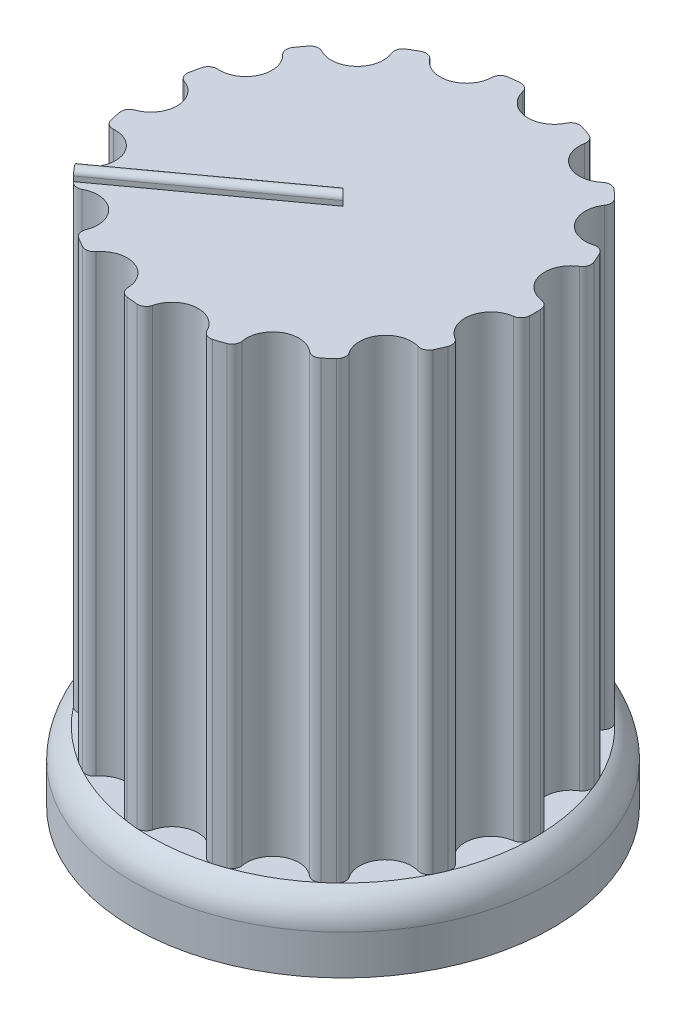
from build123d import *

# Parameters (mm, degrees)
SKETCH1_R                = 6
BOSS_EXTRUDE1_DEPTH      = 15
CUT_EXTRUDE1_START       = -13
SKETCH2_R                = 6
SKETCH2_R_2              = 5.5
CUT_EXTRUDE1_DEPTH       = 13
FILLET1_R                = 1
SKETCH3_R                = 0.75
CUT_EXTRUDE2_DEPTH       = 13
FILLET2_R                = 0.25
CIRPATTERN1_COUNT        = 15
FILLET2_OF_CIRPATTERN1_R = 0.25
SKETCH4_R                = 3.5
CUT_EXTRUDE3_DEPTH       = 14
BOSS_EXTRUDE2_DEPTH      = 7
FILLET3_R                = 0.25
BOSS_EXTRUDE3_DEPTH      = 0.3
FILLET4_R                = 0.159518


# Some blends are built 0.0001 mm under size
with BuildPart() as part:
    # Sketch1 → Boss-Extrude1 (new body)
    with BuildSketch(Plane(origin=(0, 0, 0), x_dir=(1, 0, 0), z_dir=(0, 1, 0))):
        with Locations(Location((0, 0, 0), (0, 0, 270))):
            Circle(SKETCH1_R)
    extrude(amount=BOSS_EXTRUDE1_DEPTH)

    # Sketch2 → Cut-Extrude1 (cut)
    with BuildSketch(Plane(origin=(0, 15, 0), x_dir=(1, 0, 0), z_dir=(0, 1, 0)).offset(CUT_EXTRUDE1_START)):
        with Locations(Location((0, 0, 0), (0, 0, 270))):
            Circle(SKETCH2_R)
        with Locations(Location((0, 0, 0), (0, 0, 270))):
            Circle(SKETCH2_R_2, mode=Mode.SUBTRACT)
    extrude(amount=CUT_EXTRUDE1_DEPTH, mode=Mode.SUBTRACT)

    # Fillet1
    # the kernel refuses this fillet: 1 mm, written as the material it takes off along each edge
    with BuildSketch(Plane(origin=(0, 2, 0), x_dir=(0, 0, 1), z_dir=(-1, 0, 0))) as fillet1_piece_1:
        with BuildLine():
            CenterArc((5, -0.866025404), FILLET1_R, 0, 60)
            Line((5.5, 0), (5.51, 0.017320508))
            ThreePointArc((5.51, 0.017320508), (5.75, 0.02), (6, 0.02))
            Line((6, 0.02), (6.02, 0))
            Line((6.02, 0), (6.02, -0.866025404))
            Line((6.02, -0.866025404), (6, -0.866025404))
        make_face()
    revolve(axis=Axis((0, 2, 0), (0, 1, 0)), mode=Mode.SUBTRACT)

    # Sketch3 → Cut-Extrude2 (cut)
    with BuildSketch(Plane(origin=(0, 15, 0), x_dir=(1, 0, 0), z_dir=(0, 1, 0))):
        with Locations((-5.5, 0)):
            Circle(SKETCH3_R)
    cut_extrude2 = extrude(amount=-CUT_EXTRUDE2_DEPTH, mode=Mode.SUBTRACT)

    # Fillet2
    fillet2_edges = [part.edges().sort_by_distance(p)[0] for p in [
        (-5.448863636, 8.5, 0.748254684),
        (-5.448863636, 8.5, -0.748254684),
    ]]
    fillet(fillet2_edges, radius=FILLET2_R)

    # CirPattern1: Cut-Extrude2 ×15 about axis
    cirpattern1_axis = Axis((0, 0, 0), (0, 1, 0))
    for i in range(1, CIRPATTERN1_COUNT):
        add(cut_extrude2.rotate(cirpattern1_axis, i * 360 / CIRPATTERN1_COUNT), mode=Mode.SUBTRACT)

    # Fillet2 of CirPattern1
    fillet2_of_cirpattern1_edges = [part.edges().sort_by_distance(p)[0] for p in [
        (-4.673442026, 8.5, 2.899817172),
        (-5.282127223, 8.5, 1.532687836),
        (-3.089939832, 8.5, 4.549974927),
        (-4.202063026, 8.5, 3.548614706),
        (-0.97215897, 8.5, 5.413400681),
        (-2.395423957, 8.5, 4.950953854),
        (1.313717009, 8.5, 5.340800279),
        (-0.174594324, 8.5, 5.497228104),
        (3.372439383, 8.5, 4.344726989),
        (2.076424253, 8.5, 5.092981673),
        (4.84803635, 8.5, 2.597410932),
        (3.968410214, 8.5, 3.808112443),
        (5.485363789, 8.5, 0.400978928),
        (5.174221996, 8.5, 1.864785976),
        (5.174221996, 8.5, -1.864785976),
        (5.485363789, 8.5, -0.400978928),
        (3.968410214, 8.5, -3.808112443),
        (4.84803635, 8.5, -2.597410932),
        (2.076424253, 8.5, -5.092981673),
        (3.372439383, 8.5, -4.344726989),
        (-0.174594324, 8.5, -5.497228104),
        (1.313717009, 8.5, -5.340800279),
        (-2.395423957, 8.5, -4.950953854),
        (-0.97215897, 8.5, -5.413400681),
        (-4.202063026, 8.5, -3.548614706),
        (-3.089939832, 8.5, -4.549974927),
        (-5.282127223, 8.5, -1.532687836),
        (-4.673442026, 8.5, -2.899817172),
    ]]
    fillet(fillet2_of_cirpattern1_edges, radius=FILLET2_OF_CIRPATTERN1_R)

    # Sketch4 → Cut-Extrude3 (cut)
    with BuildSketch(Plane.XZ):
        with Locations(Location((0, 0, 0), (0, 0, 270))):
            Circle(SKETCH4_R)
    extrude(amount=-CUT_EXTRUDE3_DEPTH, mode=Mode.SUBTRACT)

    # Sketch5 → Boss-Extrude2 (add)
    with BuildSketch(Plane.XZ.offset(-14)):
        Polygon((3.406463932, -1.678047733), (-3.746712586, 2.451840655), (-3.996712586, 2.018827953), (3.156463932, -2.111060435), align=None)
    extrude(amount=BOSS_EXTRUDE2_DEPTH)

    # Fillet3
    fillet3_edges = [part.edges().sort_by_distance(p)[0] for p in [
        (0.125, 14, 0.216506351),
        (-0.125, 14, -0.216506351),
    ]]
    fillet(fillet3_edges, radius=FILLET3_R)

    # Sketch6 → Boss-Extrude3 (add)
    with BuildSketch(Plane(origin=(0, 15, 0), x_dir=(1, 0, 0), z_dir=(0, 1, 0))):
        Polygon((-4.353959196, -3.360511765), (-4.541483996, -3.10240602), (-0.114230541, 0.114181898), (0, 0), (0.114230541, -0.114181898), align=None)
    extrude(amount=BOSS_EXTRUDE3_DEPTH)

    # Fillet4
    fillet4_edges = [part.edges().sort_by_distance(p)[0] for p in [
        (-2.119864328, 15.3, 1.737346831),
        (-2.327857269, 15.3, 1.494112061),
    ]]
    fillet(fillet4_edges, radius=FILLET4_R - 0.0001)  # a hair under: the kernel refuses the full size


solid = part.part
